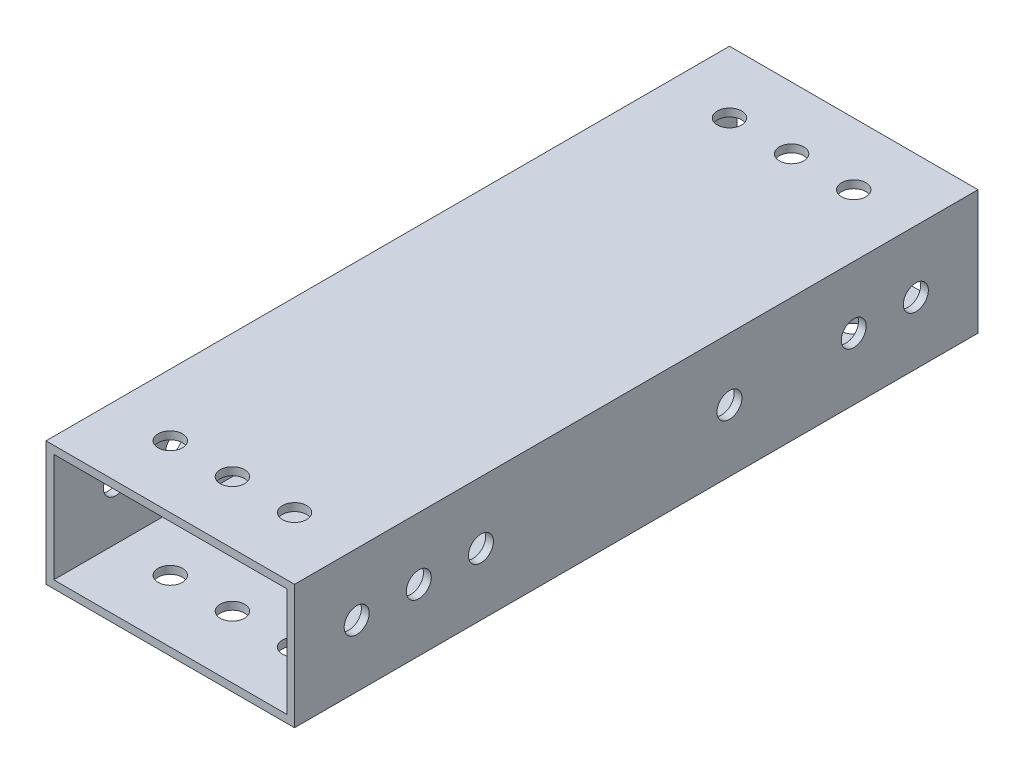
from build123d import *

# Parameters (mm, degrees)
SKETCH1_W           = 50.8
SKETCH1_H           = 25.4
SKETCH1_W_2         = 47.625
SKETCH1_H_2         = 22.225
BOSS_EXTRUDE1_DEPTH = 69.85
SKETCH2_R           = 2.4892
CUT_EXTRUDE1_DEPTH  = 79.545162168
SKETCH3_R           = 2.5527
CUT_EXTRUDE2_DEPTH  = 88.298066989
SKETCH5_R           = 2.5527
CUT_EXTRUDE3_DEPTH  = 88.298066989


with BuildPart() as part:
    # Sketch1 → Boss-Extrude1 (new, symmetric)
    with BuildSketch(Plane.XY):
        Rectangle(SKETCH1_W, SKETCH1_H)
        Rectangle(SKETCH1_W_2, SKETCH1_H_2, mode=Mode.SUBTRACT)
    extrude(amount=BOSS_EXTRUDE1_DEPTH, both=True)

    # Sketch2 → Cut-Extrude1 (cut, through all)
    with BuildSketch(Plane(origin=(0, 12.7, 0), x_dir=(1, 0, 0), z_dir=(0, 1, 0))):
        with Locations((-12.7, 57.15)):
            Circle(SKETCH2_R)
        with Locations((0, 57.15)):
            Circle(SKETCH2_R)
        with Locations((12.7, 57.15)):
            Circle(SKETCH2_R)
        with Locations((12.7, -57.15)):
            Circle(SKETCH2_R)
        with Locations((0, -57.15)):
            Circle(SKETCH2_R)
        with Locations((-12.7, -57.15)):
            Circle(SKETCH2_R)
    extrude(amount=-CUT_EXTRUDE1_DEPTH, mode=Mode.SUBTRACT)

    # Sketch3 → Cut-Extrude2 (cut, through all)
    with BuildSketch(Plane.ZY.offset(25.4)):
        with Locations((-57.15, 0)):
            Circle(SKETCH3_R)
        with Locations((57.15, 0)):
            Circle(SKETCH3_R)
        with Locations((31.75, 0)):
            Circle(SKETCH3_R)
        with Locations((44.45, 0)):
            Circle(SKETCH3_R)
    extrude(amount=-CUT_EXTRUDE2_DEPTH, mode=Mode.SUBTRACT)

    # Sketch5 → Cut-Extrude3 (cut, through all)
    with BuildSketch(Plane(origin=(25.4, 0, 0), x_dir=(0, 0, -1), z_dir=(1, 0, 0))):
        with Locations((44.45, 0)):
            Circle(SKETCH5_R)
        with Locations((19.05, 0)):
            Circle(SKETCH5_R)
    extrude(amount=-CUT_EXTRUDE3_DEPTH, mode=Mode.SUBTRACT)


solid = part.part
